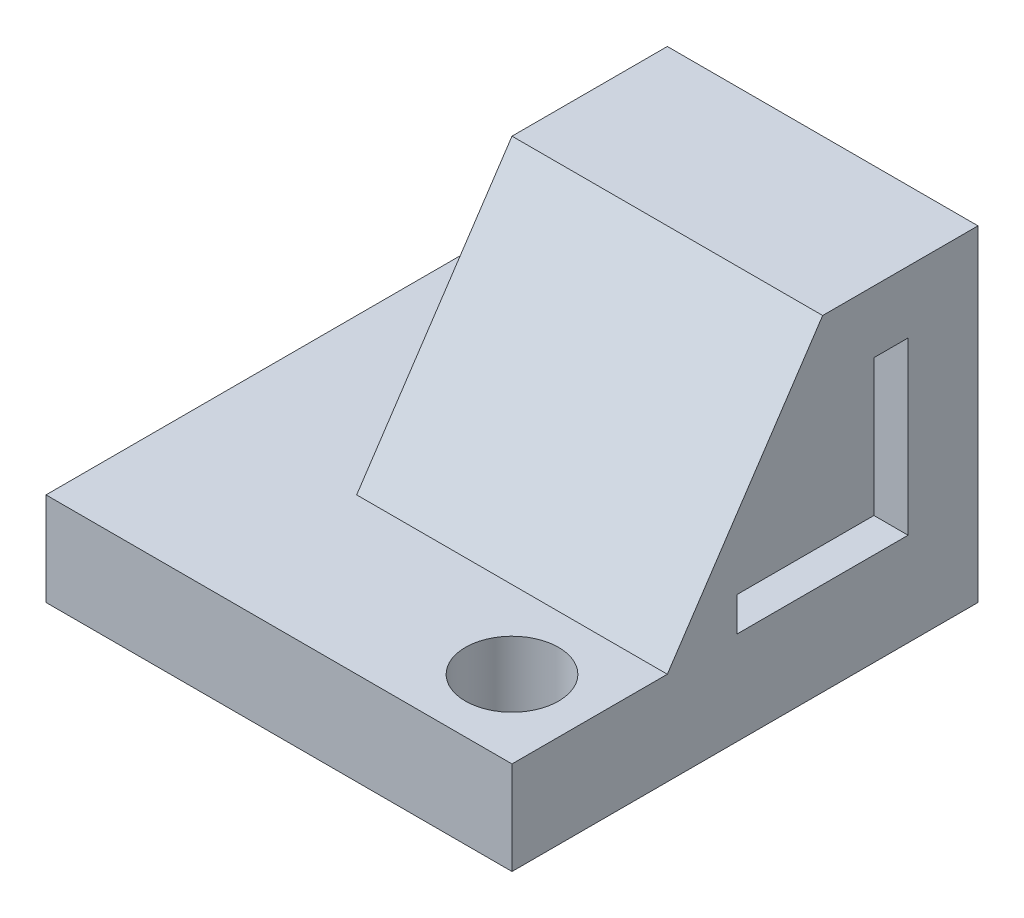
from build123d import *

# Parameters (mm, degrees)
SKETCH1_W           = 38.1
SKETCH1_H           = 38.1
BOSS_EXTRUDE1_DEPTH = 7.62
SKETCH2_W           = 25.4
SKETCH2_H           = 25.4
BOSS_EXTRUDE2_DEPTH = 19.05
CUT_EXTRUDE1_REACH  = 34.996
SKETCH3_R           = 3.81
CUT_EXTRUDE2_DEPTH  = 6.35
CUT_EXTRUDE3_REACH  = 52.257


with BuildPart() as part:
    # Sketch1 → Boss-Extrude1 (new body)
    with BuildSketch(Plane(origin=(0, 0, 0), x_dir=(1, 0, 0), z_dir=(0, 1, 0))):
        Rectangle(SKETCH1_W, SKETCH1_H)
    extrude(amount=BOSS_EXTRUDE1_DEPTH)

    # Sketch2 → Boss-Extrude2 (add)
    with BuildSketch(Plane(origin=(0, 7.62, 0), x_dir=(1, 0, 0), z_dir=(0, 1, 0))):
        with Locations((6.35, 6.35)):
            Rectangle(SKETCH2_W, SKETCH2_H)
    extrude(amount=BOSS_EXTRUDE2_DEPTH)

    # Sketch3 → Cut-Extrude1 (cut, up to next)
    with BuildSketch(Plane(origin=(0, 7.62, 0), x_dir=(1, 0, 0), z_dir=(0, 1, 0)), mode=Mode.PRIVATE) as cut_extrude1_sk1:
        with Locations((-12.7, 12.7)):
            Circle(SKETCH3_R)
    cut_extrude1_tool1 = extrude(cut_extrude1_sk1.sketch, amount=-CUT_EXTRUDE1_REACH, mode=Mode.PRIVATE) & part.part
    # Sketch3 → Cut-Extrude1 (cut, up to next)
    with BuildSketch(Plane(origin=(0, 7.62, 0), x_dir=(1, 0, 0), z_dir=(0, 1, 0)), mode=Mode.PRIVATE) as cut_extrude1_sk2:
        with Locations((12.7, -12.7)):
            Circle(SKETCH3_R)
    cut_extrude1_tool2 = extrude(cut_extrude1_sk2.sketch, amount=-CUT_EXTRUDE1_REACH, mode=Mode.PRIVATE) & part.part
    add(cut_extrude1_tool1.solids().sort_by_distance((-12.7, 7.62, -12.7))[0], mode=Mode.SUBTRACT)
    add(cut_extrude1_tool2.solids().sort_by_distance((12.7, 7.62, 12.7))[0], mode=Mode.SUBTRACT)

    # Sketch4 → Cut-Extrude2 (cut)
    with BuildSketch(Plane(origin=(19.05, 0, 0), x_dir=(0, 0, -1), z_dir=(1, 0, 0))):
        Polygon((10.541, 21.59), (13.335, 21.59), (13.335, 7.62), (-0.635, 7.62), (-0.635, 10.414), (10.541, 10.414), align=None)
    extrude(amount=-CUT_EXTRUDE2_DEPTH, mode=Mode.SUBTRACT)

    # Sketch5 → Cut-Extrude3 (cut, up to next)
    with BuildSketch(Plane(origin=(19.05, 0, 0), x_dir=(0, 0, -1), z_dir=(1, 0, 0)), mode=Mode.PRIVATE) as cut_extrude3_sk1:
        Polygon((6.35, 26.67), (-6.35, 7.62), (-6.35, 26.67), align=None)
    cut_extrude3_tool1 = extrude(cut_extrude3_sk1.sketch, amount=-CUT_EXTRUDE3_REACH, mode=Mode.PRIVATE) & part.part
    add(cut_extrude3_tool1.solids().sort_by_distance((19.05, 20.32, 2.116667))[0], mode=Mode.SUBTRACT)


solid = part.part
